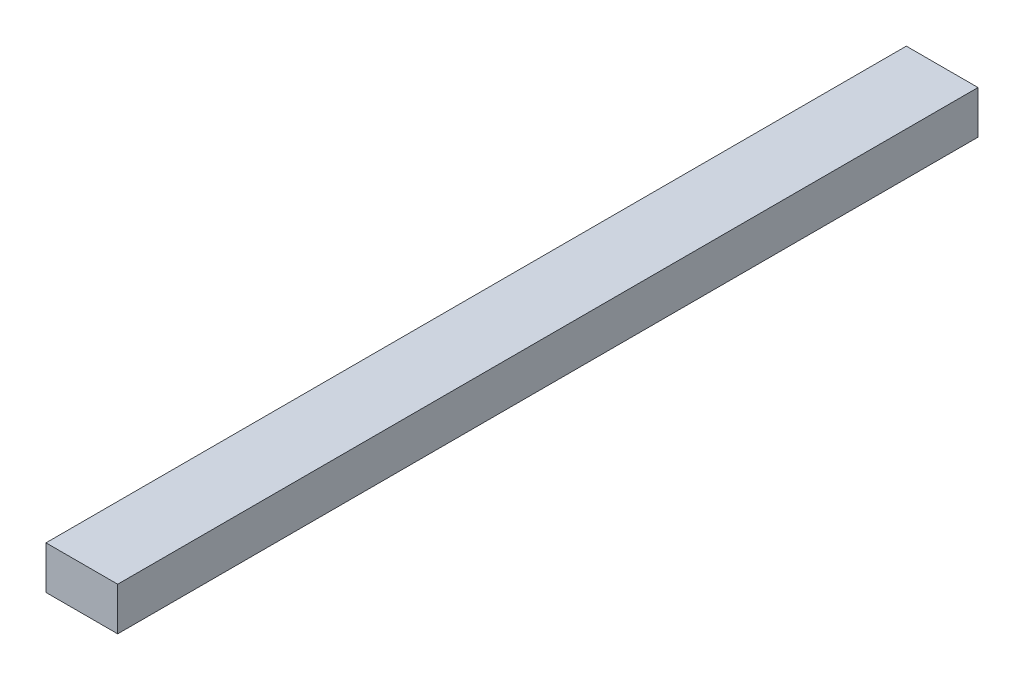
from build123d import *

# Parameters (mm, degrees)
SKETCH_1_W      = 50
SKETCH_1_H      = 30
EXTRUDE_1_DEPTH = 300


with BuildPart() as part:
    # Эскиз1 → Бобышка-Вытянуть1 (new, symmetric)
    with BuildSketch(Plane.XY):
        Rectangle(SKETCH_1_W, SKETCH_1_H)
    extrude(amount=EXTRUDE_1_DEPTH, both=True)


solid = part.part
